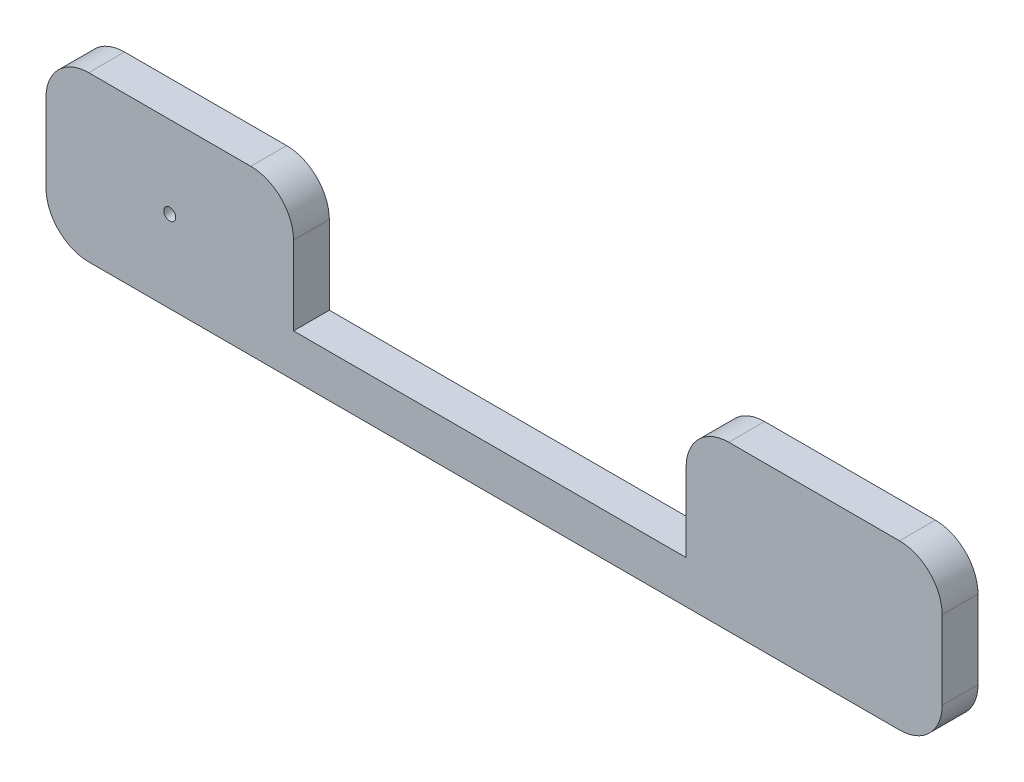
from build123d import *

# Parameters (mm, degrees)
SKETCH1_W           = 133.35
SKETCH1_H           = 24.384
BOSS_EXTRUDE1_DEPTH = 5.334
SKETCH3_W           = 58.42
SKETCH3_H           = 18.034
CUT_EXTRUDE1_DEPTH  = 104.917980915
FILLET1_R           = 6.35
SKETCH4_R           = 0.889
CUT_EXTRUDE2_DEPTH  = 104.917980915


with BuildPart() as part:
    # Sketch1 → Boss-Extrude1 (new body)
    with BuildSketch(Plane.XY):
        with Locations((-18.387445418, -47.262819662)):
            Rectangle(SKETCH1_W, SKETCH1_H)
    extrude(amount=BOSS_EXTRUDE1_DEPTH)

    # Sketch3 → Cut-Extrude1 (cut, through all)
    with BuildSketch(Plane.XY.offset(5.334)):
        with Locations((-19.022445418, -44.087819662)):
            Rectangle(SKETCH3_W, SKETCH3_H)
    extrude(amount=-CUT_EXTRUDE1_DEPTH, mode=Mode.SUBTRACT)

    # Fillet1
    fillet1_edges = [part.edges().sort_by_distance(p)[0] for p in [
        (-85.062445418, -35.070819662, 2.667),
        (-48.232445418, -35.070819662, 2.667),
        (10.187554582, -35.070819662, 2.667),
        (48.287554582, -35.070819662, 2.667),
        (48.287554582, -59.454819662, 2.667),
        (-85.062445418, -59.454819662, 2.667),
    ]]
    fillet(fillet1_edges, radius=FILLET1_R)

    # Sketch4 → Cut-Extrude2 (cut, through all)
    with BuildSketch(Plane.XY.offset(5.334)):
        with Locations((-66.647445418, -47.262819662)):
            Circle(SKETCH4_R)
    extrude(amount=-CUT_EXTRUDE2_DEPTH, mode=Mode.SUBTRACT)


solid = part.part
